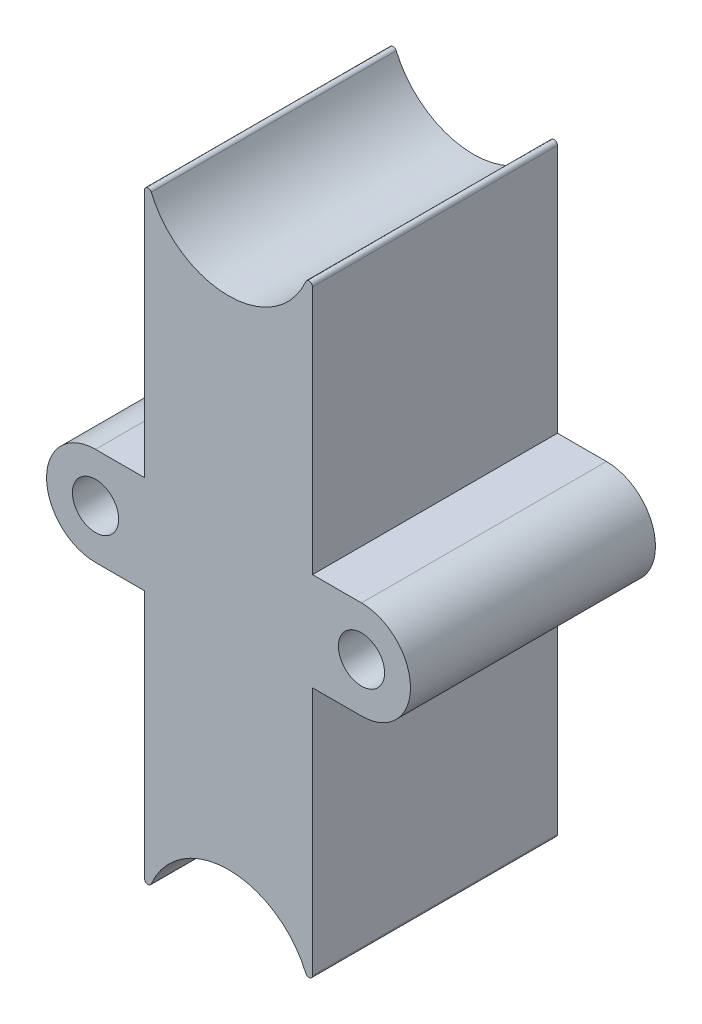
from build123d import *

# Parameters (mm, degrees)
SKETCH1_R           = 1.65
BOSS_EXTRUDE1_DEPTH = 17.5
FILLET1_R           = 0.25


with BuildPart() as part:
    # Sketch1 → Boss-Extrude1 (new body)
    with BuildSketch(Plane.XY):
        with BuildLine():
            Line((-6, -3.5), (-6, -23.75))
            ThreePointArc((-6, -23.75), (0, -17.75), (6, -23.75))
            Line((6, -23.75), (6, -3.5))
            Line((6, -3.5), (9.5, -3.5))
            ThreePointArc((9.5, -3.5), (13, 0), (9.5, 3.5))
            Line((9.5, 3.5), (6, 3.5))
            Line((6, 3.5), (6, 23.75))
            ThreePointArc((6, 23.75), (0, 17.75), (-6, 23.75))
            Line((-6, 23.75), (-6, 3.5))
            Line((-6, 3.5), (-9.5, 3.5))
            ThreePointArc((-9.5, 3.5), (-13, 0), (-9.5, -3.5))
            Line((-9.5, -3.5), (-6, -3.5))
        make_face()
        with Locations((-9.5, 0)):
            Circle(SKETCH1_R, mode=Mode.SUBTRACT)
        with Locations((9.5, 0)):
            Circle(SKETCH1_R, mode=Mode.SUBTRACT)
    extrude(amount=BOSS_EXTRUDE1_DEPTH)

    # Fillet1
    fillet1_edges = [part.edges().sort_by_distance(p)[0] for p in [
        (6, -23.75, 8.75),
        (6, 23.75, 8.75),
        (-6, 23.75, 8.75),
    ]]
    fillet(fillet1_edges, radius=FILLET1_R)
    fillet1_2_edges = [part.edges().sort_by_distance(p)[0] for p in [
        (-6, -23.75, 8.75),
    ]]
    fillet(fillet1_2_edges, radius=FILLET1_R)


solid = part.part
